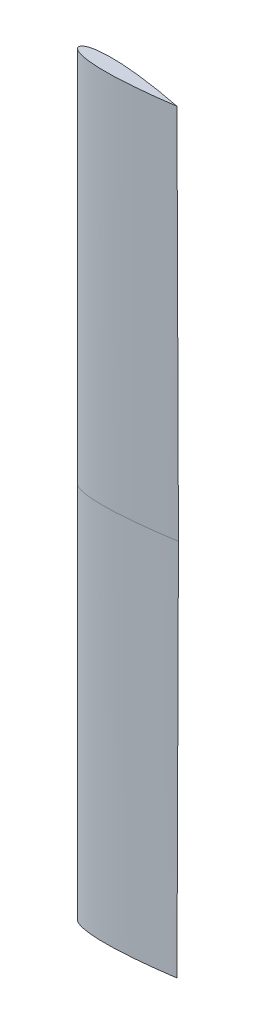
from build123d import *


with BuildPart() as part:
    # rootSketch → Loft1 section 0
    with BuildSketch(Plane(origin=(0, 0, 0), x_dir=(1, 0, 0), z_dir=(0, 1, 0))):
        with BuildLine():
            add(Edge.make_bspline(
                [(0, 0), (-2.0935e-05, 0.056642614), (0.005379395, 0.148218431), (0.026012732, 0.279547036), (0.077294223, 0.449824452), (0.145814279, 0.607708084), (0.246172486, 0.779853859), (0.3891574, 0.969729338), (0.595387566, 1.18565305), (0.901219667, 1.438985741), (1.364248225, 1.740024649), (2.070227995, 2.093878609), (3.164536558, 2.505196424), (4.80134036, 2.943083018), (7.246294164, 3.372926903), (10.404724756, 3.669229647), (14.093818027, 3.781364064), (18.115812737, 3.707379962), (21.628267735, 3.518831724), (24.63699869, 3.289606535), (27.637359979, 3.016621161), (30.14235016, 2.754453361), (32.629531865, 2.466956352), (35.635288733, 2.087032221), (38.597120414, 1.686528396), (41.628170258, 1.238652439), (44.538284592, 0.780123884), (47.116160484, 0.344886508), (48.91147999, 0.033038799), (50.655447267, -0.289143315), (51.550989376, -0.458280815), (52, -0.544562633)],
                knots=[0, 0, 0, 0, 0, 0.00384382, 0.006241333, 0.009008344, 0.012070374, 0.015524345, 0.019765532, 0.025140987, 0.032336865, 0.042479637, 0.057256916, 0.078755308, 0.111733691, 0.157569449, 0.225947504, 0.29432556, 0.362703619, 0.431081679, 0.46527071, 0.499459741, 0.5678378, 0.602026832, 0.636215863, 0.704593921, 0.772971981, 0.807161011, 0.841350041, 0.875539073, 0.909728105, 0.909728105, 0.909728105, 0.909728105, 0.909728105], degree=4))
            add(Edge.make_bspline(
                [(0, 0), (-0.001207164, -0.056629752), (0.002274162, -0.148298581), (0.020152636, -0.280030496), (0.067856859, -0.451344526), (0.133055422, -0.610628507), (0.229786469, -0.784838271), (0.368763573, -0.977666558), (0.570426543, -1.197861873), (0.870886171, -1.457543868), (1.327508696, -1.768213692), (2.025923075, -2.13677497), (3.111377647, -2.570920046), (4.738652066, -3.042989237), (7.17406768, -3.523942099), (10.32560028, -3.886325038), (14.011536106, -4.075693404), (18.034198133, -4.085955829), (21.549831447, -3.971008251), (24.562703068, -3.804843441), (27.568123303, -3.594752763), (30.078054526, -3.385103017), (32.570711634, -3.149756665), (35.58376582, -2.832863679), (38.553335442, -2.494475615), (41.593100133, -2.110175403), (44.512178928, -1.712692247), (47.098604373, -1.331537285), (48.900060982, -1.057356304), (50.650393051, -0.771767745), (51.549280901, -0.621422159), (52, -0.544562633)],
                knots=[0, 0, 0, 0, 0, 0.00384382, 0.006241333, 0.009008344, 0.012070374, 0.015524345, 0.019765532, 0.025140987, 0.032336865, 0.042479637, 0.057256916, 0.078755308, 0.111733691, 0.157569449, 0.225947504, 0.29432556, 0.362703619, 0.431081679, 0.46527071, 0.499459741, 0.5678378, 0.602026832, 0.636215863, 0.704593921, 0.772971981, 0.807161011, 0.841350041, 0.875539073, 0.909728105, 0.909728105, 0.909728105, 0.909728105, 0.909728105], degree=4))
        make_face()
    # tipSketch → Loft1 section 1
    with BuildSketch(Plane(origin=(0, 195, 0), x_dir=(1, 0, 0), z_dir=(0, 1, 0))):
        with BuildLine():
            add(Edge.make_bspline(
                [(0, 0), (-2.7077e-05, 0.056710591), (0.005394558, 0.148407841), (0.026152163, 0.280033603), (0.077746677, 0.449961904), (0.146723656, 0.607382514), (0.247379106, 0.777994339), (0.389874082, 0.964736888), (0.594162241, 1.175518343), (0.894874189, 1.42083035), (1.352902841, 1.713609092), (2.053381459, 2.05650259), (3.140591202, 2.45153249), (4.773045131, 2.86692145), (7.216429616, 3.26346005), (10.376634703, 3.515654754), (14.072298382, 3.575106761), (18.102283825, 3.442481087), (21.619422414, 3.202404761), (24.631976939, 2.928754259), (27.133363154, 2.664654323), (29.141291229, 2.431617964), (31.628362787, 2.122190717), (34.146514955, 1.778504098), (36.605563438, 1.422328305), (39.641268107, 0.949484319), (42.532207017, 0.479341097), (45.674126476, -0.076626845), (48.407393399, -0.584317621), (50.660481167, -1.033077838), (51.551318007, -1.214378891), (52, -1.307177784)],
                knots=[0, 0, 0, 0, 0, 0.003845658, 0.006245277, 0.009022611, 0.012044555, 0.015501019, 0.019679599, 0.024953702, 0.03195376, 0.041823539, 0.056555515, 0.077861291, 0.110456483, 0.156156733, 0.224644526, 0.293132328, 0.361620133, 0.43010794, 0.464351842, 0.498595745, 0.532839648, 0.567083551, 0.635571356, 0.669815259, 0.704059162, 0.772546967, 0.841034772, 0.875278677, 0.909522582, 0.909522582, 0.909522582, 0.909522582, 0.909522582], degree=4))
            add(Edge.make_bspline(
                [(0, 0), (-0.002876428, -0.056637603), (-0.002068906, -0.148491441), (0.012049034, -0.280993906), (0.055040451, -0.453299912), (0.116020817, -0.613987393), (0.20797686, -0.789441093), (0.340909107, -0.98310734), (0.53434867, -1.203886889), (0.822355272, -1.463998123), (1.265094946, -1.77942041), (1.947460379, -2.157075889), (3.01344892, -2.606232962), (4.622970054, -3.103118802), (7.043344627, -3.621922744), (10.186886887, -4.032581266), (13.874895657, -4.277644284), (17.90645474, -4.347669993), (21.431213502, -4.284613123), (24.453712422, -4.162672002), (26.9652088, -4.02458608), (28.982309526, -3.892731034), (31.481786766, -3.708655822), (34.014026699, -3.491926132), (36.487865107, -3.259753419), (39.543493273, -2.940033567), (42.454402827, -2.61573741), (45.620288136, -2.218335282), (48.375611401, -1.848616874), (50.648401073, -1.513628319), (51.547222094, -1.377315747), (52, -1.307177784)],
                knots=[0, 0, 0, 0, 0, 0.003845658, 0.006245277, 0.009022611, 0.012044555, 0.015501019, 0.019679599, 0.024953702, 0.03195376, 0.041823539, 0.056555515, 0.077861291, 0.110456483, 0.156156733, 0.224644526, 0.293132328, 0.361620133, 0.43010794, 0.464351842, 0.498595745, 0.532839648, 0.567083551, 0.635571356, 0.669815259, 0.704059162, 0.772546967, 0.841034772, 0.875278677, 0.909522582, 0.909522582, 0.909522582, 0.909522582, 0.909522582], degree=4))
        make_face()
    loft1 = loft()

    # Mirror1: Loft1 across plane
    add(loft1.mirror(Plane.ZX))


solid = part.part
